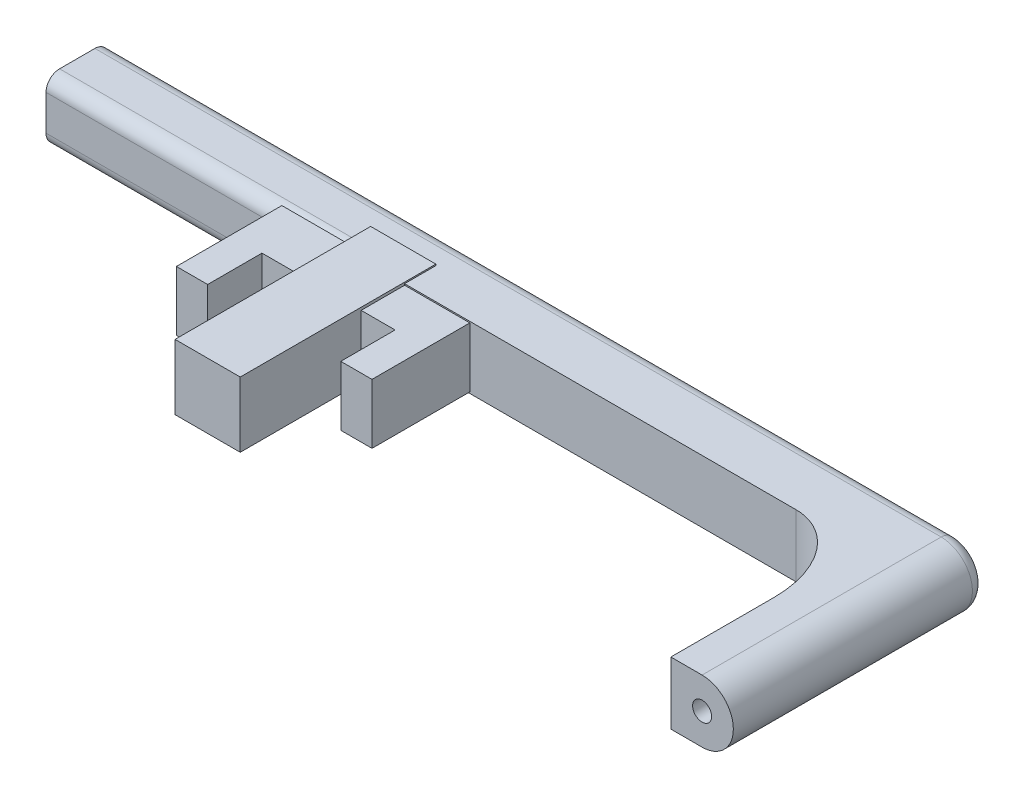
from build123d import *

# Parameters (mm, degrees)
SKETCH_1_W           = 2.4
SKETCH_1_H           = 2.4
EXTRUDE_1_DEPTH      = 7.2
EXTRUDE_2_DEPTH      = 18
EXTRUDE_2_DEPTH_BACK = 12
SKETCH_4_W           = 2.3
SKETCH_4_H           = 2.3
EXTRUDE_3_DEPTH      = 7
EXTRUDE_3_DEPTH_BACK = 2.3
SKETCH_5_R           = 0.35
SKETCH_6_R           = 0.35
CUT_EXTRUDE_1_DEPTH  = 10
FILLET_1_SIZE        = 2.4
FILLET_1_SIZE_2      = 3.2
FILLET_2_R           = 0.5
EXTRUDE_START        = -1.5
SKETCH_7_W           = 1.15
SKETCH_7_H           = 0.45
SKETCH_7_H_2         = 1.3
SKETCH_7_H_3         = 2.2
EXTRUDE_4_DEPTH      = 5.1
SKETCH_8_W           = 7.2
SKETCH_8_H           = 2.2
EXTRUDE_5_DEPTH      = 3.1


with BuildPart() as part:
    # 草图1 → 凸台-拉伸1 (new body)
    with BuildSketch(Plane.XY):
        Rectangle(SKETCH_1_W, SKETCH_1_H)
    extrude(amount=EXTRUDE_1_DEPTH)

    # 草图4 → 凸台-拉伸2 (add, two sides: drawn at the far end of the back side and taken through both)
    with BuildSketch(Plane(origin=(0, 0, 0), x_dir=(0, 0, -1), z_dir=(1, 0, 0)).offset(-EXTRUDE_2_DEPTH_BACK)):
        Rectangle(SKETCH_4_W, SKETCH_4_H)
    extrude(amount=EXTRUDE_2_DEPTH + EXTRUDE_2_DEPTH_BACK)

    # 草图5 → 凸台-拉伸3 (add, two sides: drawn at the far end of the back side and taken through both)
    with BuildSketch(Plane.XY.offset(1.15).offset(-EXTRUDE_3_DEPTH_BACK)):
        with BuildLine():
            Line((18, 0), (18, 1.15))
            Line((18, 1.15), (19.15, 1.15))
            ThreePointArc((19.15, 1.15), (20.3, 0), (19.15, -1.15))
            Line((19.15, -1.15), (18, -1.15))
            Line((18, -1.15), (18, 0))
        make_face()
        with Locations(Location((19.15, 0, 0), (0, 0, 180))):
            Circle(SKETCH_5_R, mode=Mode.SUBTRACT)
    extrude(amount=EXTRUDE_3_DEPTH + EXTRUDE_3_DEPTH_BACK)

    # 草图6 → 切除-拉伸1 (cut)
    with BuildSketch(Plane.ZY.offset(12)):
        Circle(SKETCH_6_R)
    extrude(amount=-CUT_EXTRUDE_1_DEPTH, mode=Mode.SUBTRACT)

    # 圆角1
    # an asymmetric fillet: 3.2, 2.4 mm, written as the material it adds along each edge
    with BuildSketch(Plane(origin=(18, 1.15, 1.15), x_dir=(-1, 0, 0), z_dir=(0, -1, 0))) as fillet_1_piece_1:
        with BuildLine():
            Bezier((FILLET_1_SIZE, 0), (0, 0), (0, -FILLET_1_SIZE_2), weights=[1, 0.707106781, 1])
            Line((0, -FILLET_1_SIZE_2), (0, 0))
            Line((0, 0), (FILLET_1_SIZE, 0))
        make_face()
    extrude(amount=2.3)

    # 圆角2
    fillet_2_edges = [part.edges().sort_by_distance(p)[0] for p in [
        (-6.6, -1.15, 1.15),
        (3.575, -1.15, -1.15),
        (-6.6, 1.15, 1.15),
        (3.575, 1.15, -1.15),
        (20.3, 0, -1.15),
    ]]
    fillet(fillet_2_edges, radius=FILLET_2_R)

    # 草图7 → 凸台-拉伸4 (add)
    with BuildSketch(Plane.XY.offset(1.15).offset(EXTRUDE_START)):
        with Locations((-3.025, 0.875)):
            Rectangle(SKETCH_7_W, SKETCH_7_H)
        with Locations((-3.025, 0)):
            Rectangle(SKETCH_7_W, SKETCH_7_H_2)
        with Locations((-3.025, -0.875)):
            Rectangle(SKETCH_7_W, SKETCH_7_H)
        with Locations((3.025, 0)):
            Rectangle(SKETCH_7_W, SKETCH_7_H_3)
    extrude(amount=EXTRUDE_4_DEPTH)

    # 草图8 → 凸台-拉伸5 (add)
    with BuildSketch(Plane.XY.offset(1.15).offset(EXTRUDE_START)):
        Rectangle(SKETCH_8_W, SKETCH_8_H)
    extrude(amount=EXTRUDE_5_DEPTH)


solid = part.part
